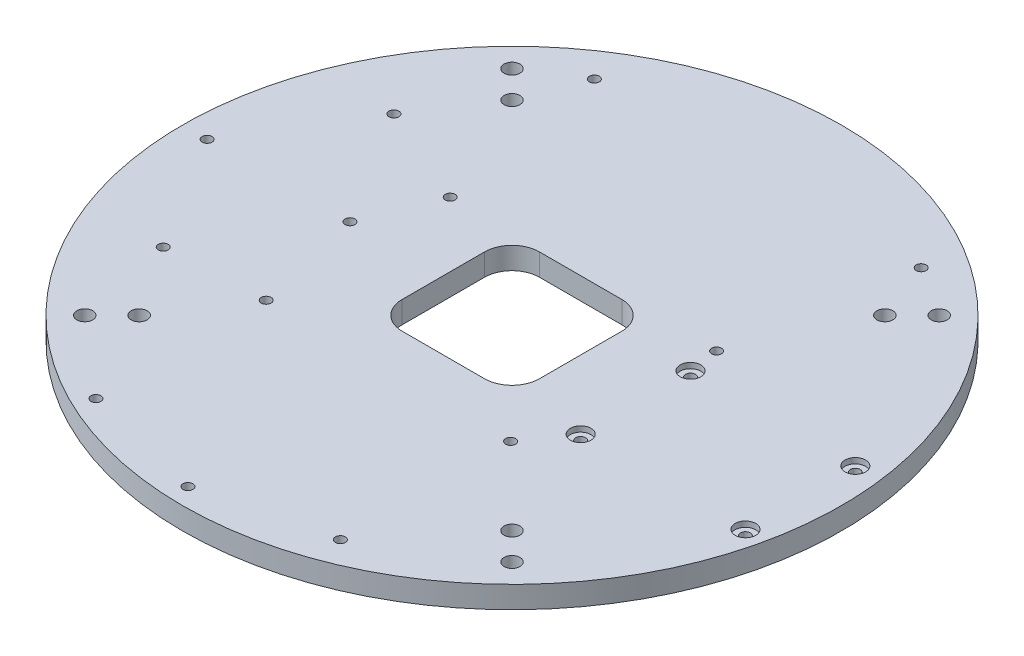
from build123d import *

# Parameters (mm, degrees)
SKETCH1_R               = 120
BOSS_EXTRUDE1_DEPTH     = 5
CUT_EXTRUDE1_REACH      = 171.779
CUT_EXTRUDE2_REACH      = 171.779
SKETCH4_R               = 1.8
SKETCH6_R               = 3.75
CUT_EXTRUDE4_DEPTH      = 2
BOSS_EXTRUDE2_OUTLINE_R = 120
BOSS_EXTRUDE2_DEPTH     = 3
CUT_EXTRUDE3_REACH      = 171.894
SKETCH5_R               = 2.9
CIRPATTERN1_COUNT       = 4


# Read off the part's stored shape, not the designer's step: Boss-Extrude2
with BuildPart() as part:
    # Sketch1 → Boss-Extrude1 (new body)
    with BuildSketch(Plane(origin=(0, 0, 0), x_dir=(1, 0, 0), z_dir=(0, 1, 0))):
        with Locations(Location((0, 0, 0), (0, 0, 270))):
            Circle(SKETCH1_R)
    extrude(amount=BOSS_EXTRUDE1_DEPTH)

    # Sketch3 → Cut-Extrude1 (cut, up to next)
    with BuildSketch(Plane(origin=(0, 5, 0), x_dir=(1, 0, 0), z_dir=(0, 1, 0)), mode=Mode.PRIVATE) as cut_extrude1_sk1:
        with BuildLine():
            Line((-15, -25), (15, -25))
            ThreePointArc((15, -25), (22.071067812, -22.071067812), (25, -15))
            Line((25, -15), (25, 15))
            ThreePointArc((25, 15), (22.071067812, 22.071067812), (15, 25))
            Line((15, 25), (-15, 25))
            ThreePointArc((-15, 25), (-22.071067812, 22.071067812), (-25, 15))
            Line((-25, 15), (-25, -15))
            ThreePointArc((-25, -15), (-22.071067812, -22.071067812), (-15, -25))
        make_face()
    cut_extrude1_tool1 = extrude(cut_extrude1_sk1.sketch, amount=-CUT_EXTRUDE1_REACH, mode=Mode.PRIVATE) & part.part
    add(cut_extrude1_tool1.solids().sort_by_distance((0, 5, 0))[0], mode=Mode.SUBTRACT)

    # Sketch4 → Cut-Extrude2 (cut, up to next)
    with BuildSketch(Plane(origin=(0, 5, 0), x_dir=(1, 0, 0), z_dir=(0, 1, 0)), mode=Mode.PRIVATE) as cut_extrude2_sk1:
        with Locations(Location((48.5, 26, 0), (0, 0, 270))):
            Circle(SKETCH4_R)
    cut_extrude2_tool1 = extrude(cut_extrude2_sk1.sketch, amount=-CUT_EXTRUDE2_REACH, mode=Mode.PRIVATE) & part.part
    # Sketch4 → Cut-Extrude2 (cut, up to next)
    with BuildSketch(Plane(origin=(0, 5, 0), x_dir=(1, 0, 0), z_dir=(0, 1, 0)), mode=Mode.PRIVATE) as cut_extrude2_sk2:
        with Locations(Location((59.5, 89.5, 0), (0, 0, 270))):
            Circle(SKETCH4_R)
    cut_extrude2_tool2 = extrude(cut_extrude2_sk2.sketch, amount=-CUT_EXTRUDE2_REACH, mode=Mode.PRIVATE) & part.part
    # Sketch4 → Cut-Extrude2 (cut, up to next)
    with BuildSketch(Plane(origin=(0, 5, 0), x_dir=(1, 0, 0), z_dir=(0, 1, 0)), mode=Mode.PRIVATE) as cut_extrude2_sk3:
        with Locations(Location((-48.5, 26, 0), (0, 0, 270))):
            Circle(SKETCH4_R)
    cut_extrude2_tool3 = extrude(cut_extrude2_sk3.sketch, amount=-CUT_EXTRUDE2_REACH, mode=Mode.PRIVATE) & part.part
    # Sketch4 → Cut-Extrude2 (cut, up to next)
    with BuildSketch(Plane(origin=(0, 5, 0), x_dir=(1, 0, 0), z_dir=(0, 1, 0)), mode=Mode.PRIVATE) as cut_extrude2_sk4:
        with Locations(Location((-59.5, 89.5, 0), (0, 0, 270))):
            Circle(SKETCH4_R)
    cut_extrude2_tool4 = extrude(cut_extrude2_sk4.sketch, amount=-CUT_EXTRUDE2_REACH, mode=Mode.PRIVATE) & part.part
    # Sketch4 → Cut-Extrude2 (cut, up to next)
    with BuildSketch(Plane(origin=(0, 5, 0), x_dir=(1, 0, 0), z_dir=(0, 1, 0)), mode=Mode.PRIVATE) as cut_extrude2_sk5:
        with Locations(Location((-85, 42, 0), (0, 0, 270))):
            Circle(SKETCH4_R)
    cut_extrude2_tool5 = extrude(cut_extrude2_sk5.sketch, amount=-CUT_EXTRUDE2_REACH, mode=Mode.PRIVATE) & part.part
    # Sketch4 → Cut-Extrude2 (cut, up to next)
    with BuildSketch(Plane(origin=(0, 5, 0), x_dir=(1, 0, 0), z_dir=(0, 1, 0)), mode=Mode.PRIVATE) as cut_extrude2_sk6:
        with Locations(Location((-59, 0, 0), (0, 0, 270))):
            Circle(SKETCH4_R)
    cut_extrude2_tool6 = extrude(cut_extrude2_sk6.sketch, amount=-CUT_EXTRUDE2_REACH, mode=Mode.PRIVATE) & part.part
    # Sketch4 → Cut-Extrude2 (cut, up to next)
    with BuildSketch(Plane(origin=(0, 5, 0), x_dir=(1, 0, 0), z_dir=(0, 1, 0)), mode=Mode.PRIVATE) as cut_extrude2_sk7:
        with Locations(Location((-111, 0, 0), (0, 0, 270))):
            Circle(SKETCH4_R)
    cut_extrude2_tool7 = extrude(cut_extrude2_sk7.sketch, amount=-CUT_EXTRUDE2_REACH, mode=Mode.PRIVATE) & part.part
    # Sketch4 → Cut-Extrude2 (cut, up to next)
    with BuildSketch(Plane(origin=(0, 5, 0), x_dir=(1, 0, 0), z_dir=(0, 1, 0)), mode=Mode.PRIVATE) as cut_extrude2_sk8:
        with Locations(Location((-85, -42, 0), (0, 0, 270))):
            Circle(SKETCH4_R)
    cut_extrude2_tool8 = extrude(cut_extrude2_sk8.sketch, amount=-CUT_EXTRUDE2_REACH, mode=Mode.PRIVATE) & part.part
    # Sketch4 → Cut-Extrude2 (cut, up to next)
    with BuildSketch(Plane(origin=(0, 5, 0), x_dir=(1, 0, 0), z_dir=(0, 1, 0)), mode=Mode.PRIVATE) as cut_extrude2_sk9:
        with Locations(Location((-49.5, -40, 0), (0, 0, 270))):
            Circle(SKETCH4_R)
    cut_extrude2_tool9 = extrude(cut_extrude2_sk9.sketch, amount=-CUT_EXTRUDE2_REACH, mode=Mode.PRIVATE) & part.part
    # Sketch4 → Cut-Extrude2 (cut, up to next)
    with BuildSketch(Plane(origin=(0, 5, 0), x_dir=(1, 0, 0), z_dir=(0, 1, 0)), mode=Mode.PRIVATE) as cut_extrude2_sk10:
        with Locations(Location((-49.5, -102, 0), (0, 0, 270))):
            Circle(SKETCH4_R)
    cut_extrude2_tool10 = extrude(cut_extrude2_sk10.sketch, amount=-CUT_EXTRUDE2_REACH, mode=Mode.PRIVATE) & part.part
    # Sketch4 → Cut-Extrude2 (cut, up to next)
    with BuildSketch(Plane(origin=(0, 5, 0), x_dir=(1, 0, 0), z_dir=(0, 1, 0)), mode=Mode.PRIVATE) as cut_extrude2_sk11:
        with Locations(Location((-5, -113, 0), (0, 0, 270))):
            Circle(SKETCH4_R)
    cut_extrude2_tool11 = extrude(cut_extrude2_sk11.sketch, amount=-CUT_EXTRUDE2_REACH, mode=Mode.PRIVATE) & part.part
    # Sketch4 → Cut-Extrude2 (cut, up to next)
    with BuildSketch(Plane(origin=(0, 5, 0), x_dir=(1, 0, 0), z_dir=(0, 1, 0)), mode=Mode.PRIVATE) as cut_extrude2_sk12:
        with Locations(Location((39.5, -102, 0), (0, 0, 270))):
            Circle(SKETCH4_R)
    cut_extrude2_tool12 = extrude(cut_extrude2_sk12.sketch, amount=-CUT_EXTRUDE2_REACH, mode=Mode.PRIVATE) & part.part
    # Sketch4 → Cut-Extrude2 (cut, up to next)
    with BuildSketch(Plane(origin=(0, 5, 0), x_dir=(1, 0, 0), z_dir=(0, 1, 0)), mode=Mode.PRIVATE) as cut_extrude2_sk13:
        with Locations(Location((39.5, -40, 0), (0, 0, 270))):
            Circle(SKETCH4_R)
    cut_extrude2_tool13 = extrude(cut_extrude2_sk13.sketch, amount=-CUT_EXTRUDE2_REACH, mode=Mode.PRIVATE) & part.part
    # Sketch4 → Cut-Extrude2 (cut, up to next)
    with BuildSketch(Plane(origin=(0, 5, 0), x_dir=(1, 0, 0), z_dir=(0, 1, 0)), mode=Mode.PRIVATE) as cut_extrude2_sk14:
        with Locations(Location((50, -25, 0), (0, 0, 270))):
            Circle(SKETCH4_R)
    cut_extrude2_tool14 = extrude(cut_extrude2_sk14.sketch, amount=-CUT_EXTRUDE2_REACH, mode=Mode.PRIVATE) & part.part
    # Sketch4 → Cut-Extrude2 (cut, up to next)
    with BuildSketch(Plane(origin=(0, 5, 0), x_dir=(1, 0, 0), z_dir=(0, 1, 0)), mode=Mode.PRIVATE) as cut_extrude2_sk15:
        with Locations(Location((110, -25, 0), (0, 0, 270))):
            Circle(SKETCH4_R)
    cut_extrude2_tool15 = extrude(cut_extrude2_sk15.sketch, amount=-CUT_EXTRUDE2_REACH, mode=Mode.PRIVATE) & part.part
    # Sketch4 → Cut-Extrude2 (cut, up to next)
    with BuildSketch(Plane(origin=(0, 5, 0), x_dir=(1, 0, 0), z_dir=(0, 1, 0)), mode=Mode.PRIVATE) as cut_extrude2_sk16:
        with Locations(Location((110, 15, 0), (0, 0, 270))):
            Circle(SKETCH4_R)
    cut_extrude2_tool16 = extrude(cut_extrude2_sk16.sketch, amount=-CUT_EXTRUDE2_REACH, mode=Mode.PRIVATE) & part.part
    # Sketch4 → Cut-Extrude2 (cut, up to next)
    with BuildSketch(Plane(origin=(0, 5, 0), x_dir=(1, 0, 0), z_dir=(0, 1, 0)), mode=Mode.PRIVATE) as cut_extrude2_sk17:
        with Locations(Location((50, 15, 0), (0, 0, 270))):
            Circle(SKETCH4_R)
    cut_extrude2_tool17 = extrude(cut_extrude2_sk17.sketch, amount=-CUT_EXTRUDE2_REACH, mode=Mode.PRIVATE) & part.part
    add(cut_extrude2_tool1.solids().sort_by_distance((48.5, 5, -26))[0], mode=Mode.SUBTRACT)
    add(cut_extrude2_tool2.solids().sort_by_distance((59.5, 5, -89.5))[0], mode=Mode.SUBTRACT)
    add(cut_extrude2_tool3.solids().sort_by_distance((-48.5, 5, -26))[0], mode=Mode.SUBTRACT)
    add(cut_extrude2_tool4.solids().sort_by_distance((-59.5, 5, -89.5))[0], mode=Mode.SUBTRACT)
    add(cut_extrude2_tool5.solids().sort_by_distance((-85, 5, -42))[0], mode=Mode.SUBTRACT)
    add(cut_extrude2_tool6.solids().sort_by_distance((-59, 5, 0))[0], mode=Mode.SUBTRACT)
    add(cut_extrude2_tool7.solids().sort_by_distance((-111, 5, 0))[0], mode=Mode.SUBTRACT)
    add(cut_extrude2_tool8.solids().sort_by_distance((-85, 5, 42))[0], mode=Mode.SUBTRACT)
    add(cut_extrude2_tool9.solids().sort_by_distance((-49.5, 5, 40))[0], mode=Mode.SUBTRACT)
    add(cut_extrude2_tool10.solids().sort_by_distance((-49.5, 5, 102))[0], mode=Mode.SUBTRACT)
    add(cut_extrude2_tool11.solids().sort_by_distance((-5, 5, 113))[0], mode=Mode.SUBTRACT)
    add(cut_extrude2_tool12.solids().sort_by_distance((39.5, 5, 102))[0], mode=Mode.SUBTRACT)
    add(cut_extrude2_tool13.solids().sort_by_distance((39.5, 5, 40))[0], mode=Mode.SUBTRACT)
    add(cut_extrude2_tool14.solids().sort_by_distance((50, 5, 25))[0], mode=Mode.SUBTRACT)
    add(cut_extrude2_tool15.solids().sort_by_distance((110, 5, 25))[0], mode=Mode.SUBTRACT)
    add(cut_extrude2_tool16.solids().sort_by_distance((110, 5, -15))[0], mode=Mode.SUBTRACT)
    add(cut_extrude2_tool17.solids().sort_by_distance((50, 5, -15))[0], mode=Mode.SUBTRACT)

    # Sketch6 → Cut-Extrude4 (cut)
    with BuildSketch(Plane(origin=(0, 5, 0), x_dir=(1, 0, 0), z_dir=(0, 1, 0))):
        with Locations(Location((50, 15, 0), (0, 0, 270))):
            Circle(SKETCH6_R)
        with Locations(Location((50, -25, 0), (0, 0, 270))):
            Circle(SKETCH6_R)
        with Locations(Location((110, -25, 0), (0, 0, 270))):
            Circle(SKETCH6_R)
        with Locations(Location((110, 15, 0), (0, 0, 270))):
            Circle(SKETCH6_R)
    extrude(amount=-CUT_EXTRUDE4_DEPTH, mode=Mode.SUBTRACT)

    # Boss-Extrude2 outline → Boss-Extrude2 (add)
    with BuildSketch(Plane.XZ):
        Circle(BOSS_EXTRUDE2_OUTLINE_R)
        with BuildLine():
            ThreePointArc((-42.169820442, -66.211451003), (-24.352147116, -74.627226472), (-5, -78.3406025))
            Line((-5, -78.3406025), (-5, -117.894020205))
            ThreePointArc((-5, -117.894020205), (-39.530133289, -111.181691668), (-70.547338387, -94.588968947))
            Line((-70.547338387, -94.588968947), (-42.169820442, -66.211451003))
        make_face(mode=Mode.SUBTRACT)
        with BuildLine():
            ThreePointArc((-74.803942321, -23.803785691), (-71.103186263, -33.265400994), (-66.211451003, -42.169820442))
            Line((-66.211451003, -42.169820442), (-94.588968947, -70.547338387))
            ThreePointArc((-94.588968947, -70.547338387), (-105.535448809, -52.785121432), (-113.18245448, -33.372623479))
            Line((-113.18245448, -33.372623479), (-74.803942321, -23.803785691))
        make_face(mode=Mode.SUBTRACT)
        with BuildLine():
            Line((-32.228597844, -25.157530032), (-54.67871527, -47.607647458))
            ThreePointArc((-54.67871527, -47.607647458), (-63.100787956, -35.700708108), (-68.969338915, -22.349055676))
            Line((-68.969338915, -22.349055676), (-35, -13.879548246))
            Line((-35, -13.879548246), (-35, -15))
            ThreePointArc((-35, -15), (-34.294713743, -20.264410847), (-32.228597844, -25.157530032))
        make_face(mode=Mode.SUBTRACT)
        with BuildLine():
            Line((-5, -35), (-5, -72.327380707))
            ThreePointArc((-5, -72.327380707), (-27.744548846, -66.981266107), (-47.607647458, -54.67871527))
            Line((-47.607647458, -54.67871527), (-25.157530032, -32.228597844))
            ThreePointArc((-25.157530032, -32.228597844), (-20.264410847, -34.294713743), (-15, -35))
            Line((-15, -35), (-5, -35))
        make_face(mode=Mode.SUBTRACT)
        with BuildLine():
            ThreePointArc((5, -78.3406025), (24.352147116, -74.627226472), (42.169820442, -66.211451003))
            Line((42.169820442, -66.211451003), (70.547338387, -94.588968947))
            ThreePointArc((70.547338387, -94.588968947), (39.530133289, -111.181691668), (5, -117.894020205))
            Line((5, -117.894020205), (5, -78.3406025))
        make_face(mode=Mode.SUBTRACT)
        with BuildLine():
            ThreePointArc((15, -35), (20.264410847, -34.294713743), (25.157530032, -32.228597844))
            Line((25.157530032, -32.228597844), (47.607647458, -54.67871527))
            ThreePointArc((47.607647458, -54.67871527), (27.744548846, -66.981266107), (5, -72.327380707))
            Line((5, -72.327380707), (5, -35))
            Line((5, -35), (15, -35))
        make_face(mode=Mode.SUBTRACT)
        with BuildLine():
            ThreePointArc((32.228597844, -25.157530032), (34.294713743, -20.264410847), (35, -15))
            Line((35, -15), (35, -5))
            Line((35, -5), (72.327380707, -5))
            ThreePointArc((72.327380707, -5), (66.981266107, -27.744548846), (54.67871527, -47.607647458))
            Line((54.67871527, -47.607647458), (32.228597844, -25.157530032))
        make_face(mode=Mode.SUBTRACT)
        with BuildLine():
            ThreePointArc((66.211451003, -42.169820442), (74.627226472, -24.352147116), (78.3406025, -5))
            Line((78.3406025, -5), (117.894020205, -5))
            ThreePointArc((117.894020205, -5), (111.181691668, -39.530133289), (94.588968947, -70.547338387))
            Line((94.588968947, -70.547338387), (66.211451003, -42.169820442))
        make_face(mode=Mode.SUBTRACT)
        with BuildLine():
            ThreePointArc((-77.223161277, 14.100828428), (-78.5, 0), (-77.223161277, -14.100828428))
            Line((-77.223161277, -14.100828428), (-115.601673436, -23.669666216))
            ThreePointArc((-115.601673436, -23.669666216), (-118, 0), (-115.601673436, 23.669666216))
            Line((-115.601673436, 23.669666216), (-77.223161277, 14.100828428))
        make_face(mode=Mode.SUBTRACT)
        with BuildLine():
            ThreePointArc((-66.211451003, 42.169820442), (-71.103186263, 33.265400994), (-74.803942321, 23.803785691))
            Line((-74.803942321, 23.803785691), (-113.18245448, 33.372623479))
            ThreePointArc((-113.18245448, 33.372623479), (-105.535448809, 52.785121432), (-94.588968947, 70.547338387))
            Line((-94.588968947, 70.547338387), (-66.211451003, 42.169820442))
        make_face(mode=Mode.SUBTRACT)
        with BuildLine():
            Line((-35, -3.573411953), (-71.388557871, -12.646098413))
            ThreePointArc((-71.388557871, -12.646098413), (-72.5, 0), (-71.388557871, 12.646098413))
            Line((-71.388557871, 12.646098413), (-35, 3.573411953))
            Line((-35, 3.573411953), (-35, -3.573411953))
        make_face(mode=Mode.SUBTRACT)
        with BuildLine():
            Line((-35, 13.879548246), (-68.969338915, 22.349055676))
            ThreePointArc((-68.969338915, 22.349055676), (-51.710657564, 50.815921662), (-23.549332741, 68.568789748))
            Line((-23.549332741, 68.568789748), (-14.554602637, 35))
            Line((-14.554602637, 35), (-15, 35))
            ThreePointArc((-15, 35), (-29.142135624, 29.142135624), (-35, 15))
            Line((-35, 15), (-35, 13.879548246))
        make_face(mode=Mode.SUBTRACT)
        with BuildLine():
            ThreePointArc((-25.105669063, 74.377115976), (-33.884618829, 70.810187169), (-42.169820442, 66.211451003))
            Line((-42.169820442, 66.211451003), (-70.547338387, 94.588968947))
            ThreePointArc((-70.547338387, 94.588968947), (-53.704070377, 105.070799107), (-35.342846864, 112.582783655))
            Line((-35.342846864, 112.582783655), (-25.105669063, 74.377115976))
        make_face(mode=Mode.SUBTRACT)
        with BuildLine():
            Line((-25, -15), (-25, 15))
            ThreePointArc((-25, 15), (-22.071067812, 22.071067812), (-15, 25))
            Line((-15, 25), (15, 25))
            ThreePointArc((15, 25), (22.071067812, 22.071067812), (25, 15))
            Line((25, 15), (25, -15))
            ThreePointArc((25, -15), (22.071067812, -22.071067812), (15, -25))
            Line((15, -25), (-15, -25))
            ThreePointArc((-15, -25), (-22.071067812, -22.071067812), (-25, -15))
        make_face(mode=Mode.SUBTRACT)
        with BuildLine():
            Line((-4.201840833, 35), (-13.890074478, 71.156980199))
            ThreePointArc((-13.890074478, 71.156980199), (0, 72.5), (13.890074478, 71.156980199))
            Line((13.890074478, 71.156980199), (4.201840833, 35))
            Line((4.201840833, 35), (-4.201840833, 35))
        make_face(mode=Mode.SUBTRACT)
        with BuildLine():
            Line((72.327380707, 5), (35, 5))
            Line((35, 5), (35, 15))
            ThreePointArc((35, 15), (29.142135624, 29.142135624), (15, 35))
            Line((15, 35), (14.554602637, 35))
            Line((14.554602637, 35), (23.549332741, 68.568789748))
            ThreePointArc((23.549332741, 68.568789748), (57.518117171, 44.135203603), (72.327380707, 5))
        make_face(mode=Mode.SUBTRACT)
        with BuildLine():
            ThreePointArc((78.3406025, 5), (74.627226472, 24.352147116), (66.211451003, 42.169820442))
            Line((66.211451003, 42.169820442), (94.588968947, 70.547338387))
            ThreePointArc((94.588968947, 70.547338387), (111.181691668, 39.530133289), (117.894020205, 5))
            Line((117.894020205, 5), (78.3406025, 5))
        make_face(mode=Mode.SUBTRACT)
        with BuildLine():
            ThreePointArc((42.169820442, 66.211451003), (33.884618829, 70.810187169), (25.105669063, 74.377115976))
            Line((25.105669063, 74.377115976), (35.342846864, 112.582783655))
            ThreePointArc((35.342846864, 112.582783655), (53.704070377, 105.070799107), (70.547338387, 94.588968947))
            Line((70.547338387, 94.588968947), (42.169820442, 66.211451003))
        make_face(mode=Mode.SUBTRACT)
        with BuildLine():
            ThreePointArc((15.4464108, 76.965306427), (0, 78.5), (-15.4464108, 76.965306427))
            Line((-15.4464108, 76.965306427), (-25.683588601, 115.170974106))
            ThreePointArc((-25.683588601, 115.170974106), (0, 118), (25.683588601, 115.170974106))
            Line((25.683588601, 115.170974106), (15.4464108, 76.965306427))
        make_face(mode=Mode.SUBTRACT)
    extrude(amount=BOSS_EXTRUDE2_DEPTH)

    # Sketch5 → Cut-Extrude3 (cut, up to next)
    with BuildSketch(Plane(origin=(0, 5, 0), x_dir=(1, 0, 0), z_dir=(0, 1, 0)), mode=Mode.PRIVATE) as cut_extrude3_sk1:
        with Locations(Location((-77.781745931, -77.781745931, 0), (0, 0, 270))):
            Circle(SKETCH5_R)
    cut_extrude3_tool1 = extrude(cut_extrude3_sk1.sketch, amount=-CUT_EXTRUDE3_REACH, mode=Mode.PRIVATE) & part.part
    # Sketch5 → Cut-Extrude3 (cut, up to next)
    with BuildSketch(Plane(origin=(0, 5, 0), x_dir=(1, 0, 0), z_dir=(0, 1, 0)), mode=Mode.PRIVATE) as cut_extrude3_sk2:
        with Locations(Location((-67.882250994, -67.882250994, 0), (0, 0, 90))):
            Circle(SKETCH5_R)
    cut_extrude3_tool2 = extrude(cut_extrude3_sk2.sketch, amount=-CUT_EXTRUDE3_REACH, mode=Mode.PRIVATE) & part.part
    cut_extrude3_1 = cut_extrude3_tool1.solids().sort_by_distance((-77.781746, 5, 77.781746))[0]
    add(cut_extrude3_1, mode=Mode.SUBTRACT)
    cut_extrude3_2 = cut_extrude3_tool2.solids().sort_by_distance((-67.882251, 5, 67.882251))[0]
    add(cut_extrude3_2, mode=Mode.SUBTRACT)
    cut_extrude3 = cut_extrude3_1 + cut_extrude3_2  # Cut-Extrude3 as one shape, for the pattern or mirror that repeats it

    # CirPattern1: Cut-Extrude3 ×4 about axis
    cirpattern1_axis = Axis((0, 0, 0), (0, 1, 0))
    for i in range(1, CIRPATTERN1_COUNT):
        add(cut_extrude3.rotate(cirpattern1_axis, i * 360 / CIRPATTERN1_COUNT), mode=Mode.SUBTRACT)


solid = part.part
